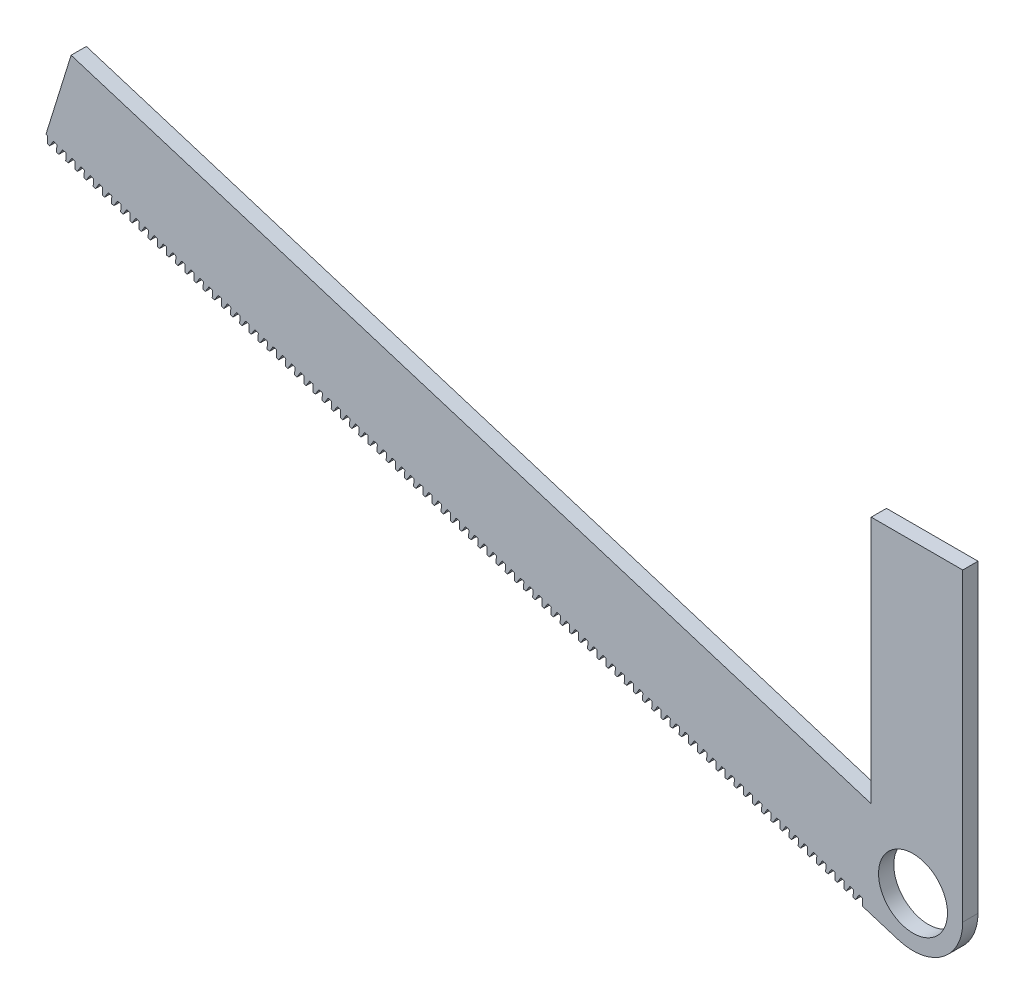
from build123d import *

# Parameters (mm, degrees)
SKETCH1_R           = 14.351
BOSS_EXTRUDE1_DEPTH = 6.35
CUT_EXTRUDE2_DEPTH  = 235.934915848
LPATTERN2_COUNT     = 90
LPATTERN2_PITCH     = 3.99034


with BuildPart() as part:
    # Sketch1 → Boss-Extrude1 (new body)
    with BuildSketch(Plane.XY):
        with BuildLine():
            Line((162.855500651, -12.532374363), (-192.744499349, 97.788648716))
            Line((-192.744499349, 97.788648716), (-181.455198725, 134.177681286))
            Line((-181.455198725, 134.177681286), (151.59035399, 30.853929578))
            Line((151.59035399, 30.853929578), (151.59035399, 134.177681286))
            Line((151.59035399, 134.177681286), (189.69035399, 134.177681286))
            Line((189.69035399, 134.177681286), (189.69035399, 7.239))
            ThreePointArc((189.69035399, 7.239), (181.268492865, -9.426957803), (162.855500651, -12.532374363))
        make_face()
        with Locations((168.98935399, 7.239)):
            Circle(SKETCH1_R, mode=Mode.SUBTRACT)
    extrude(amount=BOSS_EXTRUDE1_DEPTH)

    # Sketch2 → Cut-Extrude2 (cut, through all)
    with BuildSketch(Plane.XY.offset(6.35)):
        with BuildLine():
            Line((-191.323182079, 97.414166008), (-191.198571108, 100.021778825))
            ThreePointArc((-191.198571108, 100.021778825), (-191.253389062, 100.211215204), (-191.412709272, 100.327440075))
            Line((-191.412709272, 100.327440075), (-192.405472934, 100.635434177))
            ThreePointArc((-192.405472934, 100.635434177), (-192.602600637, 100.629793385), (-192.755014066, 100.504648284))
            Line((-192.755014066, 100.504648284), (-194.128197057, 98.284391324))
            ThreePointArc((-194.128197057, 98.284391324), (-194.153599295, 98.263533807), (-194.186453912, 98.262593675))
            Line((-194.186453912, 98.262593675), (-194.642545434, 98.404091097))
            Line((-194.642545434, 98.404091097), (-194.650071635, 98.379831742))
            Line((-194.650071635, 98.379831742), (-194.193980112, 98.23833432))
            Line((-194.193980112, 98.23833432), (-191.295018586, 97.338963112))
            Line((-191.295018586, 97.338963112), (-190.838927064, 97.19746569))
            Line((-190.838927064, 97.19746569), (-190.831400863, 97.221725045))
            Line((-190.831400863, 97.221725045), (-191.287492385, 97.363222467))
            ThreePointArc((-191.287492385, 97.363222467), (-191.314045754, 97.382593279), (-191.323182079, 97.414166008))
        make_face()
    cut_extrude2 = extrude(amount=-CUT_EXTRUDE2_DEPTH, mode=Mode.SUBTRACT)

    # LPattern2: Cut-Extrude2 ×90
    with Locations(*[Vector(0.9550927183842698, -0.2963071030018449, 0) * (i * LPATTERN2_PITCH) for i in range(1, LPATTERN2_COUNT)]):
        add(cut_extrude2, mode=Mode.SUBTRACT)


solid = part.part
